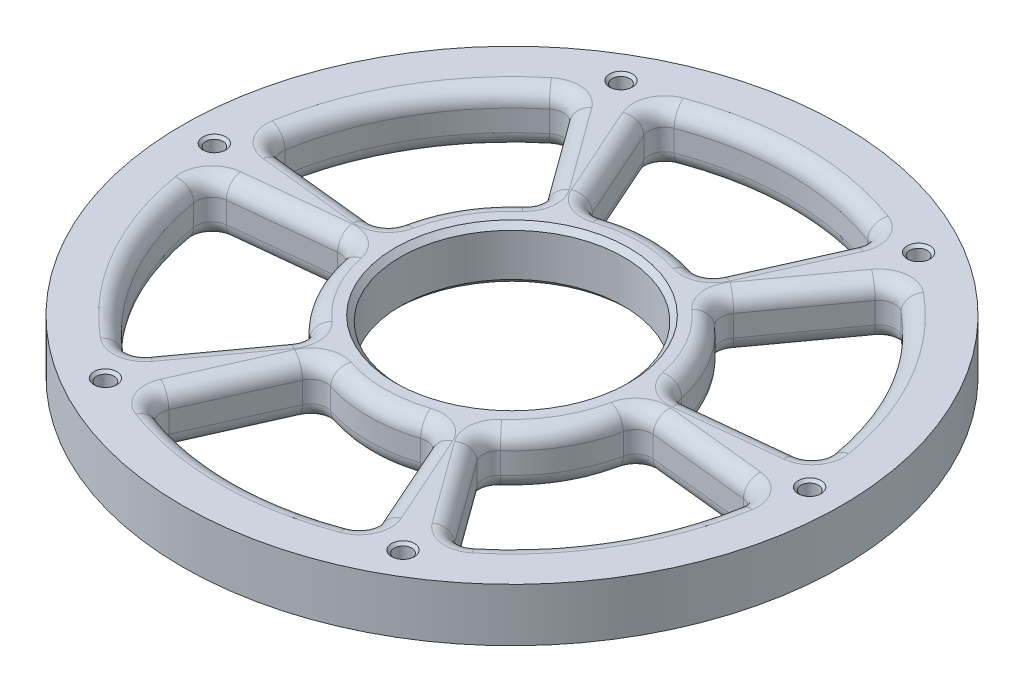
from build123d import *

# Parameters (mm, degrees)
SKETCH1_R                    = 62
SKETCH1_R_2                  = 21
BOSS_EXTRUDE1_DEPTH          = 10
SKETCH3_R                    = 1.65
CUT_EXTRUDE1_DEPTH           = 89.249645892
CHAMFER1_SIZE                = 0.5
CIRPATTERN1_COUNT            = 6
CHAMFER1_OF_CIRPATTERN1_SIZE = 0.5
CUT_EXTRUDE3_DEPTH           = 89.249645892
FILLET1_R                    = 3
CIRPATTERN2_COUNT            = 6
FILLET1_OF_CIRPATTERN2_R     = 3
CHAMFER2_SIZE                = 1


with BuildPart() as part:
    # Sketch1 → Boss-Extrude1 (new body)
    with BuildSketch(Plane(origin=(0, 0, 0), x_dir=(1, 0, 0), z_dir=(0, 1, 0))):
        Circle(SKETCH1_R)
        Circle(SKETCH1_R_2, mode=Mode.SUBTRACT)
    extrude(amount=BOSS_EXTRUDE1_DEPTH)

    # Sketch3 → Cut-Extrude1 (cut, through all)
    with BuildSketch(Plane(origin=(0, 10, 0), x_dir=(1, 0, 0), z_dir=(0, 1, 0))):
        with Locations((-56, 0)):
            Circle(SKETCH3_R)
    cut_extrude1 = extrude(amount=-CUT_EXTRUDE1_DEPTH, mode=Mode.SUBTRACT)

    # Chamfer1
    chamfer1_edges = [part.edges().sort_by_distance(p)[0] for p in [
        (-57.65, 10, 0),
    ]]
    chamfer(chamfer1_edges, length=CHAMFER1_SIZE)

    # CirPattern1: Cut-Extrude1 ×6 about axis
    cirpattern1_axis = Axis((0, 10, 0), (0, 1, 0))
    for i in range(1, CIRPATTERN1_COUNT):
        add(cut_extrude1.rotate(cirpattern1_axis, i * 360 / CIRPATTERN1_COUNT), mode=Mode.SUBTRACT)

    # Chamfer1 of CirPattern1
    chamfer1_of_cirpattern1_edges = [part.edges().sort_by_distance(p)[0] for p in [
        (-28.825, 10, 49.926364528),
        (28.825, 10, 49.926364528),
        (57.65, 10, 0),
        (28.825, 10, -49.926364528),
        (-28.825, 10, -49.926364528),
    ]]
    chamfer(chamfer1_of_cirpattern1_edges, length=CHAMFER1_OF_CIRPATTERN1_SIZE)

    # Sketch5 → Cut-Extrude3 (cut, through all)
    with BuildSketch(Plane(origin=(0, 10, 0), x_dir=(1, 0, 0), z_dir=(0, 1, 0))):
        with BuildLine():
            Line((-21.15030544, 47.504363797), (-10.981889363, 24.665727356))
            ThreePointArc((-10.981889363, 24.665727356), (0, 27), (10.981889363, 24.665727356))
            Line((10.981889363, 24.665727356), (21.15030544, 47.504363797))
            ThreePointArc((21.15030544, 47.504363797), (0, 52), (-21.15030544, 47.504363797))
        make_face()
    cut_extrude3 = extrude(amount=-CUT_EXTRUDE3_DEPTH, mode=Mode.SUBTRACT)

    # Fillet1
    fillet1_edges = [part.edges().sort_by_distance(p)[0] for p in [
        (0, 10, -52),
        (-21.15030544, 5, -47.504363797),
        (21.15030544, 5, -47.504363797),
        (10.981889363, 5, -24.665727356),
        (-10.981889363, 5, -24.665727356),
        (16.066097401, 0, -36.085045577),
        (0, 0, -27),
        (-16.066097401, 0, -36.085045577),
        (0, 0, -52),
        (0, 10, -27),
        (16.066097401, 10, -36.085045577),
        (-16.066097401, 10, -36.085045577),
    ]]
    fillet(fillet1_edges, radius=FILLET1_R)

    # CirPattern2: Cut-Extrude3 ×6 about axis
    cirpattern2_axis = Axis((0, 10, 0), (0, 1, 0))
    for i in range(1, CIRPATTERN2_COUNT):
        add(cut_extrude3.rotate(cirpattern2_axis, i * 360 / CIRPATTERN2_COUNT), mode=Mode.SUBTRACT)

    # Fillet1 of CirPattern2
    fillet1_of_cirpattern2_edges = [part.edges().sort_by_distance(p)[0] for p in [
        (-45.033320997, 10, -26),
        (-51.715138559, 5, -5.43548009),
        (-30.564833119, 5, -42.068883707),
        (-15.870201812, 5, -21.843458848),
        (-26.852091175, 5, -2.822268508),
        (-23.217517466, 0, -31.956171278),
        (-23.382685902, 0, -13.5),
        (-39.283614867, 0, -4.128874299),
        (-45.033320997, 0, -26),
        (-23.382685902, 10, -13.5),
        (-23.217517466, 10, -31.956171278),
        (-39.283614867, 10, -4.128874299),
        (-45.033320997, 10, 26),
        (-30.564833119, 5, 42.068883707),
        (-51.715138559, 5, 5.43548009),
        (-26.852091175, 5, 2.822268508),
        (-15.870201812, 5, 21.843458848),
        (-39.283614867, 0, 4.128874299),
        (-23.382685902, 0, 13.5),
        (-23.217517466, 0, 31.956171278),
        (-45.033320997, 0, 26),
        (-23.382685902, 10, 13.5),
        (-39.283614867, 10, 4.128874299),
        (-23.217517466, 10, 31.956171278),
        (0, 10, 52),
        (21.15030544, 5, 47.504363797),
        (-21.15030544, 5, 47.504363797),
        (-10.981889363, 5, 24.665727356),
        (10.981889363, 5, 24.665727356),
        (-16.066097401, 0, 36.085045577),
        (0, 0, 27),
        (16.066097401, 0, 36.085045577),
        (0, 0, 52),
        (0, 10, 27),
        (-16.066097401, 10, 36.085045577),
        (16.066097401, 10, 36.085045577),
        (45.033320997, 10, 26),
        (51.715138559, 5, 5.43548009),
        (30.564833119, 5, 42.068883707),
        (15.870201812, 5, 21.843458848),
        (26.852091175, 5, 2.822268508),
        (23.217517466, 0, 31.956171278),
        (23.382685902, 0, 13.5),
        (39.283614867, 0, 4.128874299),
        (45.033320997, 0, 26),
        (23.382685902, 10, 13.5),
        (23.217517466, 10, 31.956171278),
        (39.283614867, 10, 4.128874299),
        (45.033320997, 10, -26),
        (30.564833119, 5, -42.068883707),
        (51.715138559, 5, -5.43548009),
        (26.852091175, 5, -2.822268508),
        (15.870201812, 5, -21.843458848),
        (39.283614867, 0, -4.128874299),
        (23.382685902, 0, -13.5),
        (23.217517466, 0, -31.956171278),
        (45.033320997, 0, -26),
        (23.382685902, 10, -13.5),
        (39.283614867, 10, -4.128874299),
        (23.217517466, 10, -31.956171278),
    ]]
    fillet(fillet1_of_cirpattern2_edges, radius=FILLET1_OF_CIRPATTERN2_R)

    # Chamfer2
    chamfer2_edges = [part.edges().sort_by_distance(p)[0] for p in [
        (-21, 10, 0),
        (-21, 0, 0),
    ]]
    chamfer(chamfer2_edges, length=CHAMFER2_SIZE)


solid = part.part
